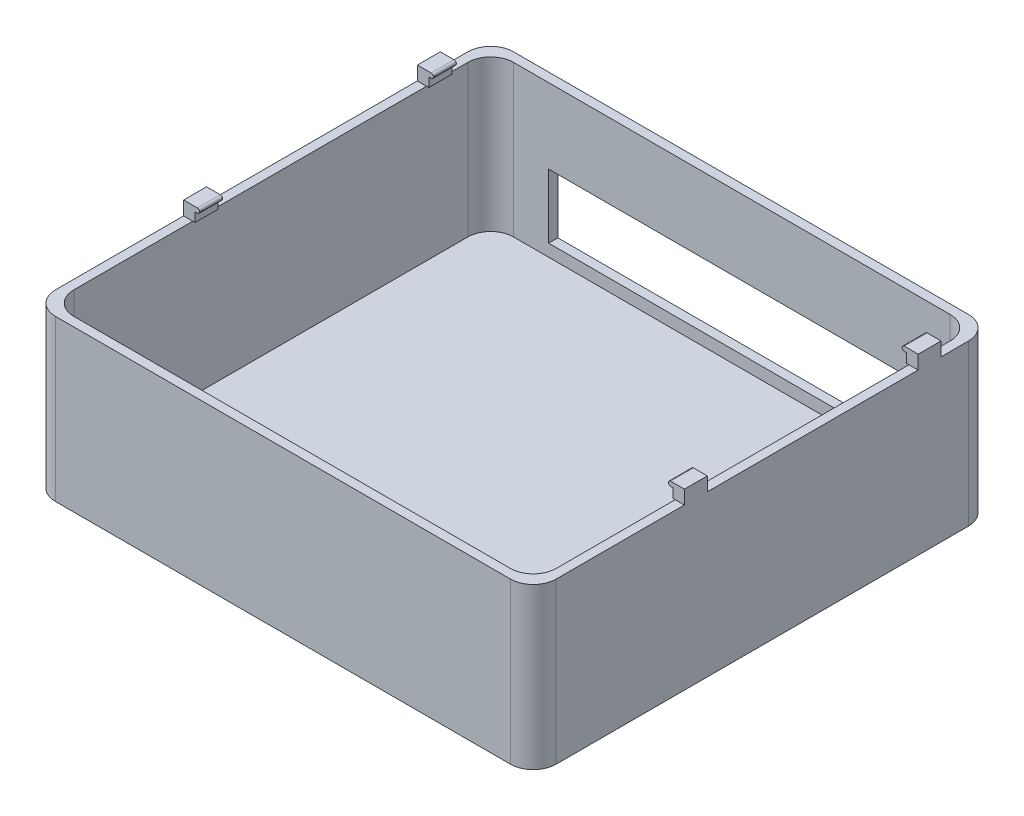
from build123d import *

# Parameters (mm, degrees)
SKETCH1_W           = 109.3
SKETCH1_H           = 100
BOSS_EXTRUDE1_DEPTH = 35
SKETCH2_W           = 2.5
SKETCH2_H           = 7
BOSS_EXTRUDE2_DEPTH = 3
SKETCH3_W           = 7
SKETCH3_H           = 1
BOSS_EXTRUDE3_DEPTH = 1
SKETCH4_W           = 7
SKETCH4_H           = 1
BOSS_EXTRUDE4_DEPTH = 1
FILLET1_R           = 0.5
SKETCH5_W           = 105.3
SKETCH5_H           = 96
CUT_EXTRUDE1_DEPTH  = 33
FILLET2_R           = 5
SKETCH6_W           = 1
SKETCH6_H           = 3
CUT_EXTRUDE2_DEPTH  = 153.939497841
CUT_EXTRUDE3_REACH  = 122.128
SKETCH7_W           = 80
SKETCH7_H           = 14


with BuildPart() as part:
    # Sketch1 → Boss-Extrude1 (new body)
    with BuildSketch(Plane(origin=(0, 0, 0), x_dir=(1, 0, 0), z_dir=(0, 1, 0))):
        with Locations((0, -50)):
            Rectangle(SKETCH1_W, SKETCH1_H)
    extrude(amount=BOSS_EXTRUDE1_DEPTH)

    # Sketch2 → Boss-Extrude2 (add)
    with BuildSketch(Plane(origin=(0, 35, 0), x_dir=(1, 0, 0), z_dir=(0, 1, 0))):
        with Locations((-53.4, -13.5)):
            Rectangle(SKETCH2_W, SKETCH2_H)
        with Locations((53.4, -13.5)):
            Rectangle(SKETCH2_W, SKETCH2_H)
        with Locations((53.4, -64.52)):
            Rectangle(SKETCH2_W, SKETCH2_H)
        with Locations((-53.4, -64.52)):
            Rectangle(SKETCH2_W, SKETCH2_H)
    extrude(amount=BOSS_EXTRUDE2_DEPTH)

    # Sketch3 → Boss-Extrude3 (add)
    with BuildSketch(Plane(origin=(-52.15, 0, 0), x_dir=(0, 0, -1), z_dir=(1, 0, 0))):
        with Locations((-13.5, 37.5)):
            Rectangle(SKETCH3_W, SKETCH3_H)
        with Locations((-64.52, 37.5)):
            Rectangle(SKETCH3_W, SKETCH3_H)
    extrude(amount=BOSS_EXTRUDE3_DEPTH)

    # Sketch4 → Boss-Extrude4 (add)
    with BuildSketch(Plane.ZY.offset(-52.15)):
        with Locations((13.5, 37.5)):
            Rectangle(SKETCH4_W, SKETCH4_H)
        with Locations((64.52, 37.5)):
            Rectangle(SKETCH4_W, SKETCH4_H)
    extrude(amount=BOSS_EXTRUDE4_DEPTH)

    # Fillet1
    fillet1_edges = [part.edges().sort_by_distance(p)[0] for p in [
        (51.15, 38, 13.5),
        (51.15, 37, 13.5),
        (51.15, 37, 64.52),
        (51.15, 38, 64.52),
        (-51.15, 37, 13.5),
        (-51.15, 38, 13.5),
        (-51.15, 37, 64.52),
        (-51.15, 38, 64.52),
    ]]
    fillet(fillet1_edges, radius=FILLET1_R - 0.0001)  # a hair under: the kernel refuses the full size

    # Sketch5 → Cut-Extrude1 (cut)
    with BuildSketch(Plane(origin=(0, 35, 0), x_dir=(1, 0, 0), z_dir=(0, 1, 0))):
        with Locations((0, -50)):
            Rectangle(SKETCH5_W, SKETCH5_H)
    extrude(amount=-CUT_EXTRUDE1_DEPTH, mode=Mode.SUBTRACT)

    # Fillet2
    fillet2_edges = [part.edges().sort_by_distance(p)[0] for p in [
        (-52.65, 18.5, 98),
        (-52.65, 18.5, 2),
        (52.65, 18.5, 2),
        (52.65, 18.5, 98),
        (-54.65, 17.5, 0),
        (54.65, 17.5, 0),
        (54.65, 17.5, 100),
        (-54.65, 17.5, 100),
    ]]
    fillet(fillet2_edges, radius=FILLET2_R)

    # Sketch6 → Cut-Extrude2 (cut, through all)
    with BuildSketch(Plane.ZY.offset(54.65)):
        with Locations((10.5, 36.5)):
            Rectangle(SKETCH6_W, SKETCH6_H)
        with Locations((16.5, 36.5)):
            Rectangle(SKETCH6_W, SKETCH6_H)
        with Locations((61.52, 36.5)):
            Rectangle(SKETCH6_W, SKETCH6_H)
        with Locations((67.52, 36.5)):
            Rectangle(SKETCH6_W, SKETCH6_H)
    extrude(amount=-CUT_EXTRUDE2_DEPTH, mode=Mode.SUBTRACT)

    # Sketch7 → Cut-Extrude3 (cut, up to next)
    with BuildSketch(Plane(origin=(0, 0, 0), x_dir=(-1, 0, 0), z_dir=(0, 0, -1)), mode=Mode.PRIVATE) as cut_extrude3_sk1:
        with Locations((0, 11.66099816)):
            Rectangle(SKETCH7_W, SKETCH7_H)
    cut_extrude3_tool1 = extrude(cut_extrude3_sk1.sketch, amount=-CUT_EXTRUDE3_REACH, mode=Mode.PRIVATE) & part.part
    add(cut_extrude3_tool1.solids().sort_by_distance((0, 11.660998, 0))[0], mode=Mode.SUBTRACT)


solid = part.part
